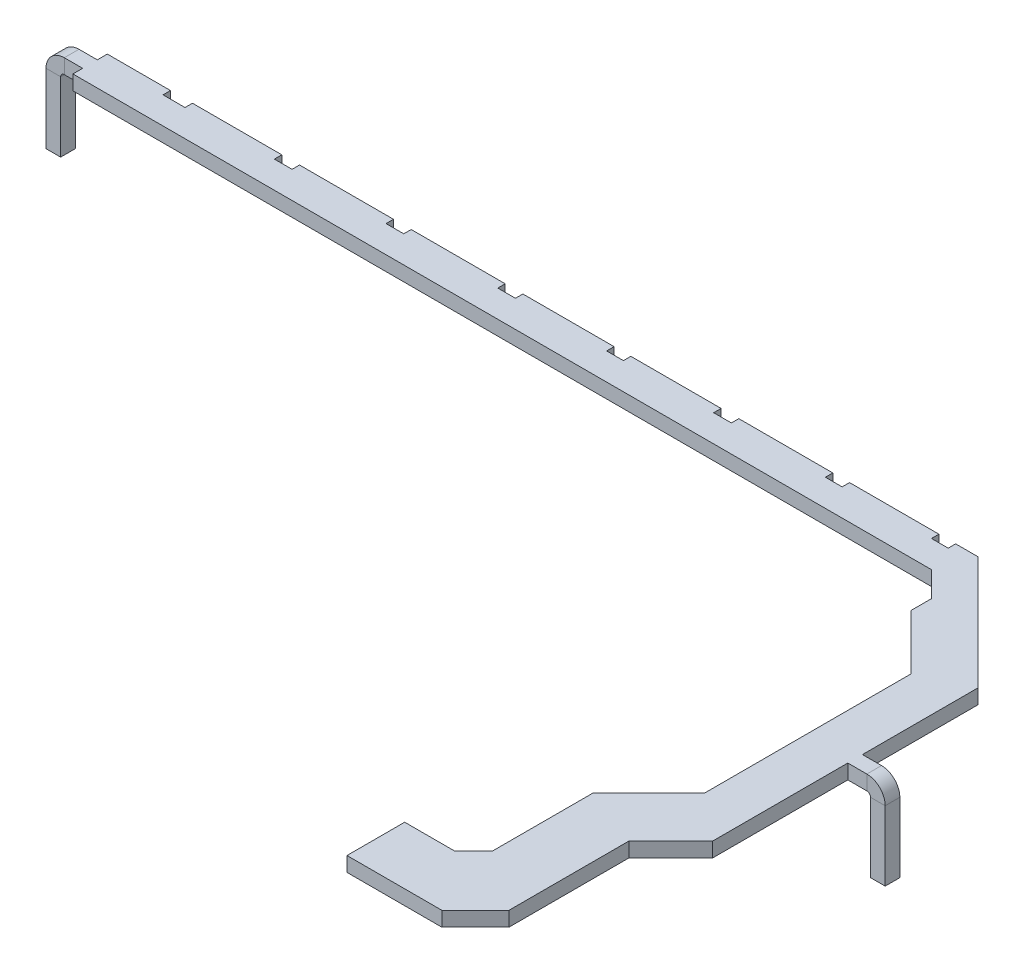
from build123d import *

# Parameters (mm, degrees)
BOSS_EXTRUDE1_DEPTH = 2
EDGE_FLANGE1_DEPTH  = 2
EDGE_FLANGE2_DEPTH  = 2
CUT_EXTRUDE3_DEPTH  = 10


# Sheet-metal steps are written as plain solids
with BuildPart() as part:
    # Sketch2 → Boss-Extrude1 (new body)
    with BuildSketch(Plane(origin=(0, 0, 0), x_dir=(1, 0, 0), z_dir=(0, 1, 0))):
        Polygon((81.609993248, 1.669814581), (81.609993248, -16.836643227), (75.909994488, -22.536641987), (75.909994488, -38.936642207), (70.009993588, -44.836643107), (58.109994528, -44.836643107), (58.109994528, -34.336641247), (63.809993288, -34.336641247), (67.509993508, -30.636641027), (67.509993508, -19.345596807), (75.109993548, -11.745596767), (75.109993548, 16.463358753), (67.709993108, 23.863356653), (67.709993108, 26.763358473), (64.309994828, 30.163356753), (-43.190006072, 30.163356753), (-52.793309772, 30.163356753), (-52.793309772, 31.563357033), (-54.793309772, 31.563357033), (-54.793309772, 33.563357033), (-52.793309772, 33.563357033), (-52.793309772, 34.963357313), (-43.190006072, 34.963357313), (66.209993568, 34.963357313), (81.609993248, 19.563357633), (81.609993248, 3.669814581), (83.609993248, 3.669814581), (83.609993248, 1.669814581), align=None)
    extrude(amount=BOSS_EXTRUDE1_DEPTH)

    # Edge-Flange1 section (across the edge) → Edge-Flange1 (add)
    with BuildSketch(Plane(origin=(-55.793309772, 0, -31.563357033), x_dir=(1, 0, 0), z_dir=(0, 0, -1))):
        with BuildLine():
            Line((-2, 0.5), (-2, 10))
            Line((-2, 10), (0, 10))
            Line((0, 10), (0, 0.5))
            ThreePointArc((0, 0.5), (0.146446609, 0.146446609), (0.5, 0))
            Line((0.5, 0), (1, 0))
            Line((1, 0), (1, -2))
            Line((1, -2), (0.5, -2))
            ThreePointArc((0.5, -2), (-1.267766953, -1.267766953), (-2, 0.5))
        make_face()
    extrude(amount=EDGE_FLANGE1_DEPTH)

    # Edge-Flange2 section (across the edge) → Edge-Flange2 (add)
    with BuildSketch(Plane(origin=(84.609993248, 0, -3.669814581), x_dir=(-1, 0, 0), z_dir=(0, 0, 1))):
        with BuildLine():
            Line((-2, 0.5), (-2, 10))
            Line((-2, 10), (0, 10))
            Line((0, 10), (0, 0.5))
            ThreePointArc((0, 0.5), (0.146446609, 0.146446609), (0.5, 0))
            Line((0.5, 0), (1, 0))
            Line((1, 0), (1, -2))
            Line((1, -2), (0.5, -2))
            ThreePointArc((0.5, -2), (-1.267766953, -1.267766953), (-2, 0.5))
        make_face()
    extrude(amount=EDGE_FLANGE2_DEPTH)

    # Sketch13 → Cut-Extrude3 (cut)
    with BuildSketch(Plane(origin=(0, 2, 0), x_dir=(1, 0, 0), z_dir=(0, 1, 0))):
        Polygon((64.364993832, 30.231358373), (-43.077006168, 30.231358373), (-52.793309772, 30.231358373), (-52.793309772, 30.163356753), (64.309994828, 30.163356753), (67.709993108, 26.763358473), (67.709993108, 23.863356653), (75.109993548, 16.463358753), (75.109993548, -11.745596767), (67.509993508, -19.345596807), (67.509993508, -30.636641027), (63.809993288, -34.336641247), (58.109994528, -34.336641247), (58.109994528, -44.836643107), (70.009993588, -44.836643107), (75.909994488, -38.936642207), (75.909994488, -22.536641987), (81.609993248, -16.836643227), (81.609993248, 1.669814581), (81.509993832, 1.669814581), (81.509993832, -16.758641627), (75.794993832, -22.473641627), (75.794993832, -38.856641627), (71.222993832, -43.428641627), (58.268993832, -43.428641627), (58.268993832, -35.554641627), (65.126993832, -35.554641627), (67.665284412, -33.016351047), (67.669899592, -19.298575587), (75.286993832, -11.672504987), (75.286993832, 16.515358373), (67.793993832, 24.008355833), (67.793993832, 26.802358373), align=None)
        Polygon((-52.793309772, 30.163356753), (-52.793309772, 30.231358373), (-53.09278865, 30.231358373), (-53.09278865, 29.122247983), (64.073173088, 29.122247983), (66.904295046, 26.802358373), (66.904295046, 23.685270997), (74.890508664, 15.670381273), (73.855495628, -9.951608799), (66.571415804, -17.811521066), (66.392045366, -24.291741654), (65.126993832, -32.125935595), (57.650093481, -33.249786732), (57.276841603, -46.73447534), (58.268993832, -46.73447534), (69.513593476, -46.73447534), (76.944541222, -41.148796497), (77.641700893, -23.890445583), (84.109993248, -17.212504202), (84.109993248, 1.669814581), (81.609993248, 1.669814581), (81.609993248, -16.836643227), (75.909994488, -22.536641987), (75.909994488, -38.936642207), (70.009993588, -44.836643107), (58.109994528, -44.836643107), (58.109994528, -34.336641247), (63.809993288, -34.336641247), (67.509993508, -30.636641027), (67.509993508, -19.345596807), (75.109993548, -11.745596767), (75.109993548, 16.463358753), (67.709993108, 23.863356653), (67.709993108, 26.763358473), (64.309994828, 30.163356753), align=None)
        Polygon((84.109993248, 19.032357692), (84.109993248, 3.669814581), (81.509993832, 3.669814581), (81.509993832, 19.436358373), (66.015993832, 34.930358373), (62.967993832, 34.930358373), (62.967993832, 33.914358373), (60.681993832, 33.914358373), (60.681993832, 34.930358373), (48.489993832, 34.930358373), (48.489993832, 33.914358373), (46.203993832, 33.914358373), (46.203993832, 34.930358373), (33.376993832, 34.930358373), (33.376993832, 33.914358373), (30.963993832, 33.914358373), (30.963993832, 34.930358373), (18.644993832, 34.930358373), (18.644993832, 33.914358373), (16.358993832, 33.914358373), (16.358993832, 34.930358373), (3.912993832, 34.930358373), (3.912993832, 33.914358373), (1.499993832, 33.914358373), (1.499993832, 34.930358373), (-11.327006168, 34.930358373), (-11.327006168, 33.914358373), (-13.740006168, 33.914358373), (-13.740006168, 34.930358373), (-26.567006168, 34.930358373), (-26.567006168, 33.914358373), (-28.980006168, 33.914358373), (-28.980006168, 34.930358373), (-41.172006168, 34.930358373), (-41.172006168, 33.914358373), (-44.172006168, 33.914358373), (-44.172006168, 34.930358373), (-54.307784522, 34.930358373), (-54.307784522, 35.697895733), (66.904295046, 35.697895733), align=None)
    extrude(amount=-CUT_EXTRUDE3_DEPTH, mode=Mode.SUBTRACT)


solid = part.part
